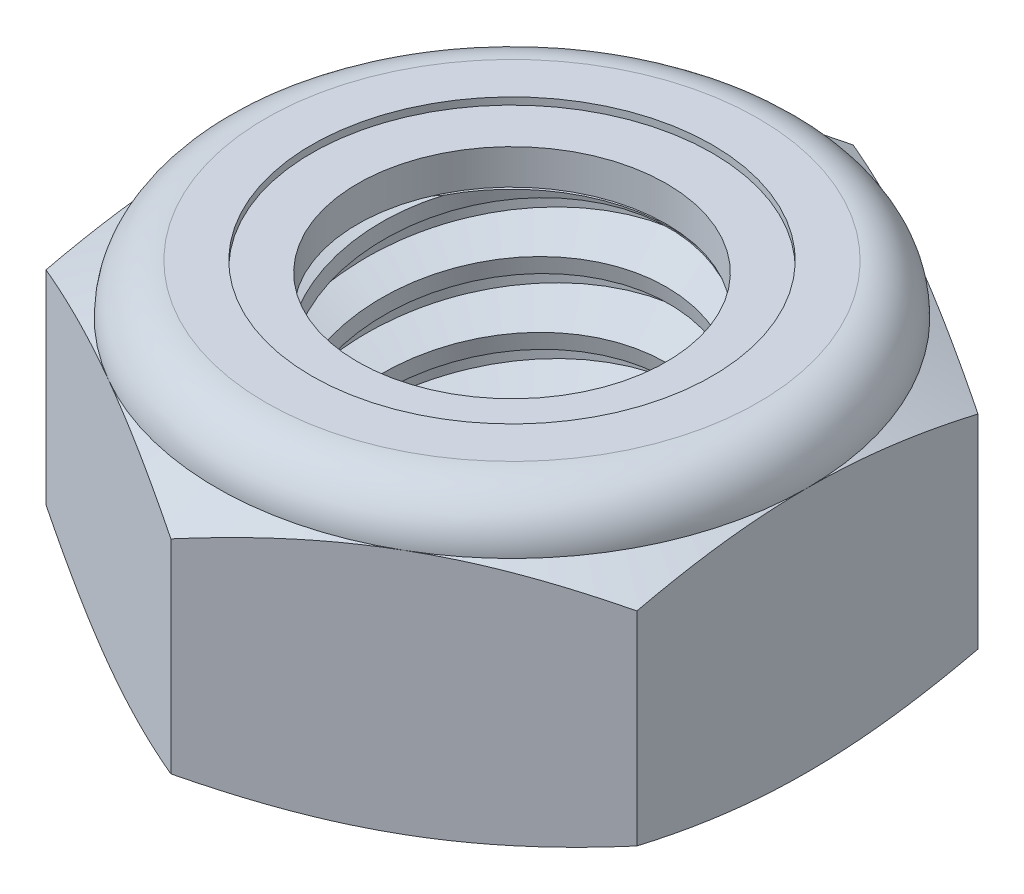
from build123d import *

# Parameters (mm, degrees)
EXTRUDE1_DEPTH       = 6.35
SKETCH2_W            = 3.9624
SKETCH2_H            = 6.35
LPATTERN1_COUNT      = 5
LPATTERN1_PITCH      = 1.411111111
LPATTERN1_COUNT_DIR2 = 2
LPATTERN1_PITCH_DIR2 = 1.411111111


with BuildPart() as part:
    # Sketch1 → Extrude1 (new body)
    with BuildSketch(Plane(origin=(0, 0, 0), x_dir=(1, 0, 0), z_dir=(0, 1, 0))):
        Polygon((0, 7.332348419), (-6.35, 3.666174209), (-6.35, -3.666174209), (0, -7.332348419), (6.35, -3.666174209), (6.35, 3.666174209), align=None)
    extrude(amount=EXTRUDE1_DEPTH)

    # Sketch4 → Cut-Revolve2 (revolve, cut)
    with BuildSketch(Plane(origin=(0, 0, 0), x_dir=(0, 0, -1), z_dir=(1, 0, 0))):
        Polygon((0, 6.35), (3.9624, 6.35), (3.318668226, 6.049822944), (3.318668226, 0.300177056), (3.9624, 0), (0, 0), align=None)
    revolve(axis=Axis((0, 6.35, 0), (0, 1, 0)), mode=Mode.SUBTRACT)


with BuildPart() as body_2:
    # Sketch2 → Revolve1 (revolve)
    with BuildSketch(Plane(origin=(0, 0, 0), x_dir=(0, 0, -1), z_dir=(1, 0, 0))):
        with Locations((1.9812, 3.175)):
            Rectangle(SKETCH2_W, SKETCH2_H)
    revolve(axis=Axis((0, -3.9624, 0), (0, 1, 0)))

    # Sketch3 → Cut-Revolve1 (revolve, cut)
    with BuildSketch(Plane(origin=(0, 0, 0), x_dir=(0, 0, -1), z_dir=(1, 0, 0))):
        Polygon((3.993321894, 6.176342646), (4.209775148, 4.960741167), (3.380512014, 5.260988826), (3.318668226, 5.608303534), align=None)
    cut_revolve1 = revolve(axis=Axis((0, 6.35, 0.26919352), (0, -0.9845141333311523, -0.17530522317150163)), mode=Mode.SUBTRACT)

    # LPattern1: Cut-Revolve1 5 × 2
    with Locations(*[Vector(0, -1, 0) * (i * LPATTERN1_PITCH) + Vector(0, 1, 0) * (j * LPATTERN1_PITCH_DIR2) for i in range(LPATTERN1_COUNT) for j in range(LPATTERN1_COUNT_DIR2) if (i, j) != (0, 0)]):
        add(cut_revolve1, mode=Mode.SUBTRACT)


with BuildPart() as part_1:
    add(part.part)

    # Combine1: cut body 2
    add(body_2.part, mode=Mode.SUBTRACT)

    # Sketch5 → Cut-Revolve3 (revolve, cut)
    with BuildSketch(Plane(origin=(0, 0, 0), x_dir=(0, 0, -1), z_dir=(1, 0, 0))):
        with BuildLine():
            Line((0, 0), (6.35, 0))
            Line((6.35, 0), (7.332348419, 0.458076591))
            Line((7.332348419, 0.458076591), (7.332348419, 4.833590076))
            Line((7.332348419, 4.833590076), (6.35, 5.291666667))
            ThreePointArc((6.35, 5.291666667), (6.040021343, 6.040021343), (5.291666667, 6.35))
            Line((5.291666667, 6.35), (5.291666667, 7.62))
            Line((5.291666667, 7.62), (8.602348419, 7.62))
            Line((8.602348419, 7.62), (8.602348419, -1.27))
            Line((8.602348419, -1.27), (0, -1.27))
            Line((0, -1.27), (0, 0))
        make_face()
    revolve(axis=Axis((0, 0, 0), (0, 1, 0)), mode=Mode.SUBTRACT)

    # Sketch6 → Cut-Revolve4 (revolve, cut)
    with BuildSketch(Plane(origin=(0, 0, 0), x_dir=(0, 0, -1), z_dir=(1, 0, 0))):
        with BuildLine():
            Line((0, 5.291666667), (6.1976, 5.291666667))
            ThreePointArc((6.1976, 5.291666667), (5.93225827, 5.93225827), (5.291666667, 6.1976))
            Line((5.291666667, 6.1976), (4.305167447, 6.1976))
            Line((4.305167447, 6.1976), (4.305167447, 7.62))
            Line((4.305167447, 7.62), (0, 7.62))
            Line((0, 7.62), (0, 5.291666667))
        make_face()
    revolve(axis=Axis((0, 7.62, 0), (0, 1, 0)), mode=Mode.SUBTRACT)


with BuildPart() as body_2_2:
    # Sketch7 → Revolve2 (revolve)
    with BuildSketch(Plane(origin=(0, 0, 0), x_dir=(0, 0, -1), z_dir=(1, 0, 0))):
        with BuildLine():
            Line((3.318668226, 5.367866667), (6.117893612, 5.367866667))
            ThreePointArc((6.117893612, 5.367866667), (5.850787282, 5.904725834), (5.291666667, 6.1214))
            Line((5.291666667, 6.1214), (3.318668226, 6.1214))
            Line((3.318668226, 6.1214), (3.318668226, 5.367866667))
        make_face()
    revolve(axis=Axis((0, 5.367866667, 0), (0, 1, 0)))


solid = Compound([part_1.part, body_2_2.part])
